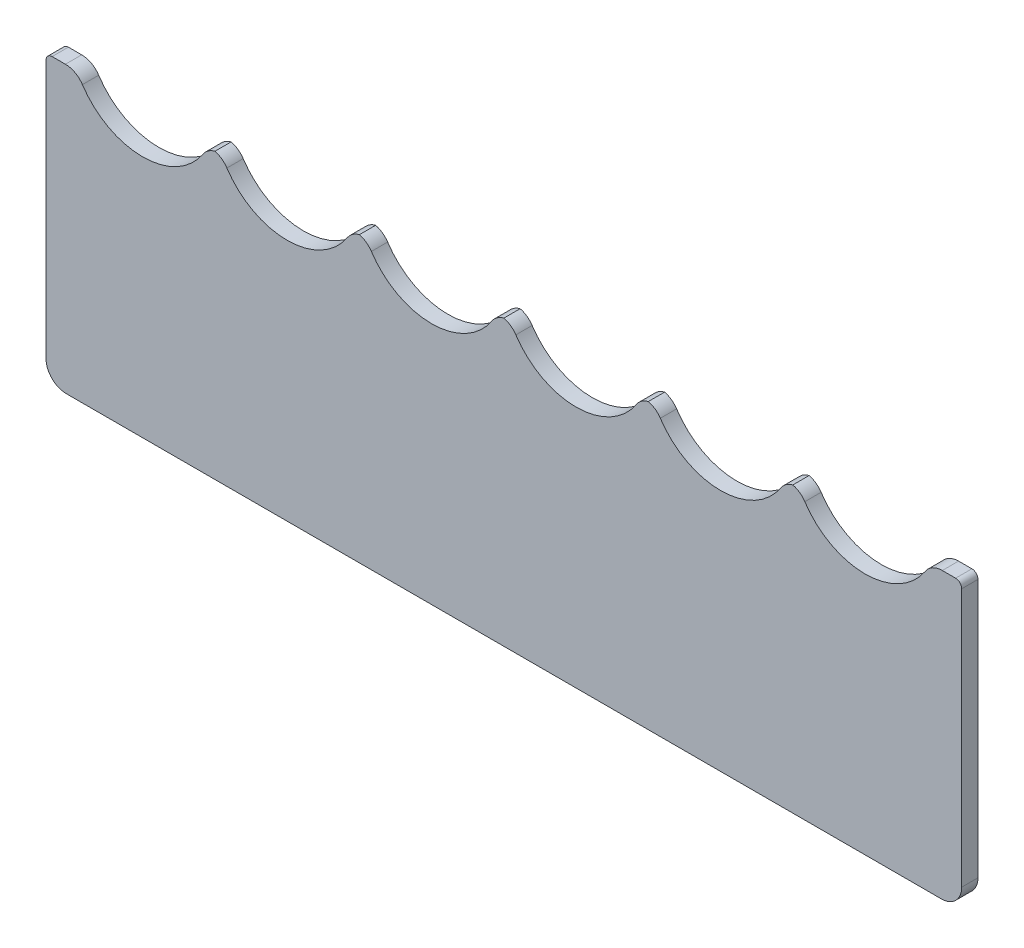
from build123d import *

# Parameters (mm, degrees)
ESQUISSE1_W                  = 450
ESQUISSE1_H                  = 140
BOSS_EXTRU_1_DEPTH           = 8
ENL_V_MAT_EXTRU_1_DEPTH      = 472.342762753
ENL_V_MAT_EXTRU_1_DEPTH_BACK = 472.342762753
ESQUISSE2_R                  = 35.45
CONG_1_R                     = 10
CONG_2_R                     = 3


with BuildPart() as part:
    # Esquisse1 → Boss.-Extru.1 (new body)
    with BuildSketch(Plane.XY):
        with Locations((225, 70)):
            Rectangle(ESQUISSE1_W, ESQUISSE1_H)
    extrude(amount=BOSS_EXTRU_1_DEPTH)

    # Esquisse2 → Enlèv. mat.-Extru.1 (cut, two sides: drawn at the far end of the back side and taken through both)
    with BuildSketch(Plane.XY.offset(8).offset(-ENL_V_MAT_EXTRU_1_DEPTH_BACK)):
        with Locations((189.5, 155)):
            Circle(ESQUISSE2_R)
        with Locations((118.5, 155)):
            Circle(ESQUISSE2_R)
        with Locations((47.5, 155)):
            Circle(ESQUISSE2_R)
        with Locations((402.5, 155)):
            Circle(ESQUISSE2_R)
        with Locations((331.5, 155)):
            Circle(ESQUISSE2_R)
        with Locations((260.5, 155)):
            Circle(ESQUISSE2_R)
    extrude(amount=ENL_V_MAT_EXTRU_1_DEPTH + ENL_V_MAT_EXTRU_1_DEPTH_BACK, mode=Mode.SUBTRACT)

    # Congé1
    # the kernel refuses this fillet: 10 mm, written as the material it takes off along each edge
    with BuildSketch(Plane(origin=(221.620126089, 140, -14.591152386), x_dir=(-0.4878841610391912, -0.87290838316921, 0), z_dir=(0, 0, 1)), Plane(origin=(150.620126089, 140, -14.591152386), x_dir=(-0.4878841610391912, -0.87290838316921, 0), z_dir=(0, 0, 1)), Plane(origin=(79.620126089, 140, -14.591152386), x_dir=(-0.4878841610391912, -0.87290838316921, 0), z_dir=(0, 0, 1)), Plane(origin=(363.620126089, 140, -14.591152386), x_dir=(-0.48788416103919546, -0.8729083831692078, 0), z_dir=(0, 0, 1)), Plane(origin=(292.620126089, 140, -14.591152386), x_dir=(-0.48788416103919546, -0.8729083831692078, 0), z_dir=(0, 0, 1))) as cong_1_piece_1:
        with BuildLine():
            CenterArc((5.881566976, 9.973537305), CONG_1_R, 209.201608238, 56.629213342)
            Line((-2.847516856, 5.094695695), (0, 0))
            ThreePointArc((0, 0), (2.577275022, 0.093810253), (5.154550044, 0))
        make_face()
    extrude(amount=37.182304771, mode=Mode.SUBTRACT)
    with BuildSketch(Plane(origin=(157.379873911, 140, -14.591152386), x_dir=(-1, 0, 0), z_dir=(0, 0, 1)), Plane(origin=(86.379873911, 140, -14.591152386), x_dir=(-1, 0, 0), z_dir=(0, 0, 1)), Plane(origin=(15.379873911, 140, -14.591152386), x_dir=(-1, 0, 0), z_dir=(0, 0, 1)), Plane(origin=(370.379873911, 140, -14.591152386), x_dir=(-1, 0, 0), z_dir=(0, 0, 1)), Plane(origin=(299.379873911, 140, -14.591152386), x_dir=(-1, 0, 0), z_dir=(0, 0, 1)), Plane(origin=(228.379873911, 140, -14.591152386), x_dir=(-1, 0, 0), z_dir=(0, 0, 1))) as cong_1_piece_2:
        with BuildLine():
            CenterArc((5.836460954, 10), CONG_1_R, 213.370786658, 56.629213342)
            ThreePointArc((-2.514823324, 4.499449945), (-1.175523906, 2.295493509), (0, 0))
            Line((0, 0), (5.836460954, 0))
        make_face()
    extrude(amount=37.182304771, mode=Mode.SUBTRACT)
    with BuildSketch(Plane(origin=(434.620126089, 140, -14.591152386), x_dir=(1, 0, 0), z_dir=(0, 0, 1))) as cong_1_piece_3:
        with BuildLine():
            CenterArc((5.836460954, -10), CONG_1_R, 90, 56.629213342)
            ThreePointArc((-2.514823324, -4.499449945), (-1.175523906, -2.295493509), (0, 0))
            Line((0, 0), (5.836460954, 0))
        make_face()
    extrude(amount=37.182304771, mode=Mode.SUBTRACT)
    with BuildSketch(Plane(origin=(450, 0, -25), x_dir=(-1, 0, 0), z_dir=(0, 0, 1))) as cong_1_piece_4:
        with BuildLine():
            CenterArc((CONG_1_R, -CONG_1_R), CONG_1_R, 90, 90)
            Line((0, -CONG_1_R), (0, 0))
            Line((0, 0), (CONG_1_R, 0))
        make_face()
    extrude(amount=58, mode=Mode.SUBTRACT)
    with BuildSketch(Plane(origin=(0, 0, -25), x_dir=(1, 0, 0), z_dir=(0, 0, 1))) as cong_1_piece_5:
        with BuildLine():
            CenterArc((CONG_1_R, CONG_1_R), CONG_1_R, 180, 90)
            Line((0, CONG_1_R), (0, 0))
            Line((0, 0), (CONG_1_R, 0))
        make_face()
    extrude(amount=58, mode=Mode.SUBTRACT)

    # Congé2
    cong_2_edges = [part.edges().sort_by_distance(p)[0] for p in [
        (0, 140, 4),
        (450, 140, 4),
    ]]
    fillet(cong_2_edges, radius=CONG_2_R)


solid = part.part
